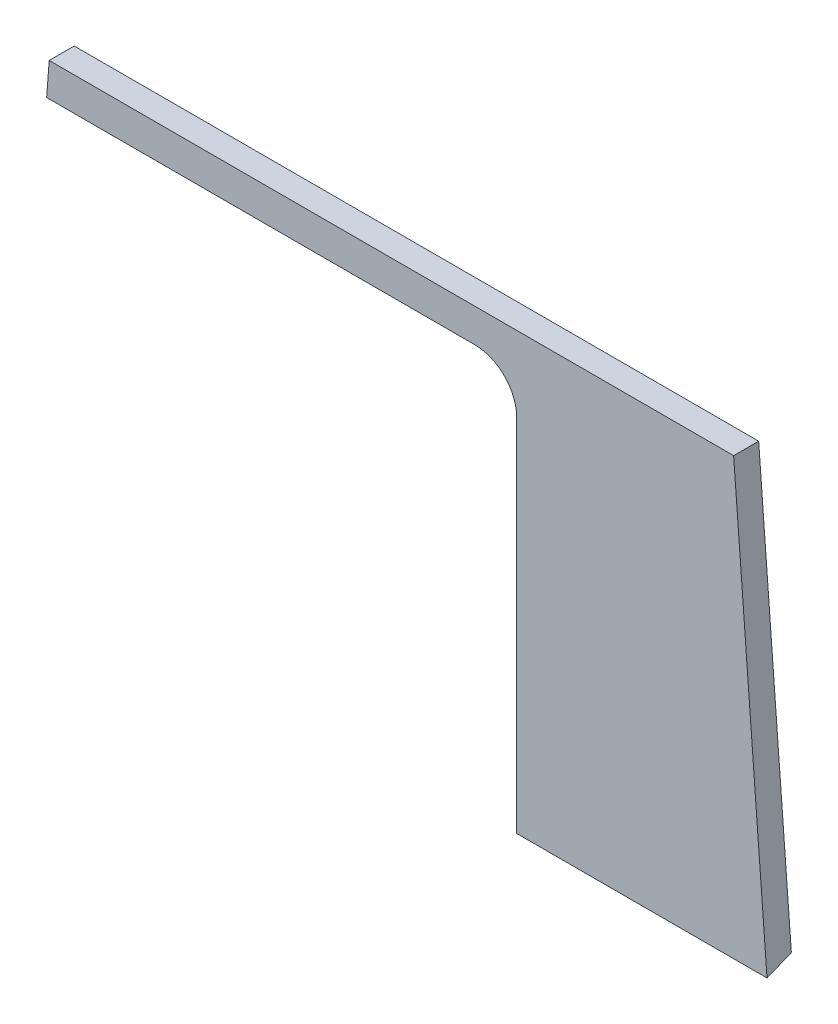
from build123d import *

# Parameters (mm, degrees)
BOSS_EXTRUDE1_DEPTH = 1.5
CHAMFER1_SIZE2      = 1.091910703
CHAMFER1_SIZE       = 3
SKETCH3_W           = 60
SKETCH3_H           = 48.2
CUT_EXTRUDE2_DEPTH  = 69.98434605
FILLET1_R           = 5


with BuildPart() as part:
    # Sketch1 → Boss-Extrude1 (new, symmetric)
    with BuildSketch(Plane.XY):
        Polygon((-45, 0), (45, 0), (41, 52.2), (-41, 52.2), align=None)
    extrude(amount=BOSS_EXTRUDE1_DEPTH, both=True)

    # Chamfer1
    chamfer1_edges = [part.edges().sort_by_distance(p)[0] for p in [
        (0, 0, -1.5),
    ]]
    chamfer1_side = [part.faces().sort_by_distance(p)[0] for p in [
        (0, 0, -1.478161786),
    ]]
    chamfer(chamfer1_edges, length=CHAMFER1_SIZE - 0.0001, length2=CHAMFER1_SIZE2 - 0.0001, reference=chamfer1_side[0])  # a hair under: the kernel refuses the full size

    # Sketch3 → Cut-Extrude2 (cut, through all)
    with BuildSketch(Plane.XY.offset(1.5)):
        with Locations((-15, 24.1)):
            Rectangle(SKETCH3_W, SKETCH3_H)
    extrude(amount=-CUT_EXTRUDE2_DEPTH, mode=Mode.SUBTRACT)

    # Fillet1
    fillet1_edges = [part.edges().sort_by_distance(p)[0] for p in [
        (15, 48.2, 0),
    ]]
    fillet(fillet1_edges, radius=FILLET1_R)


solid = part.part
